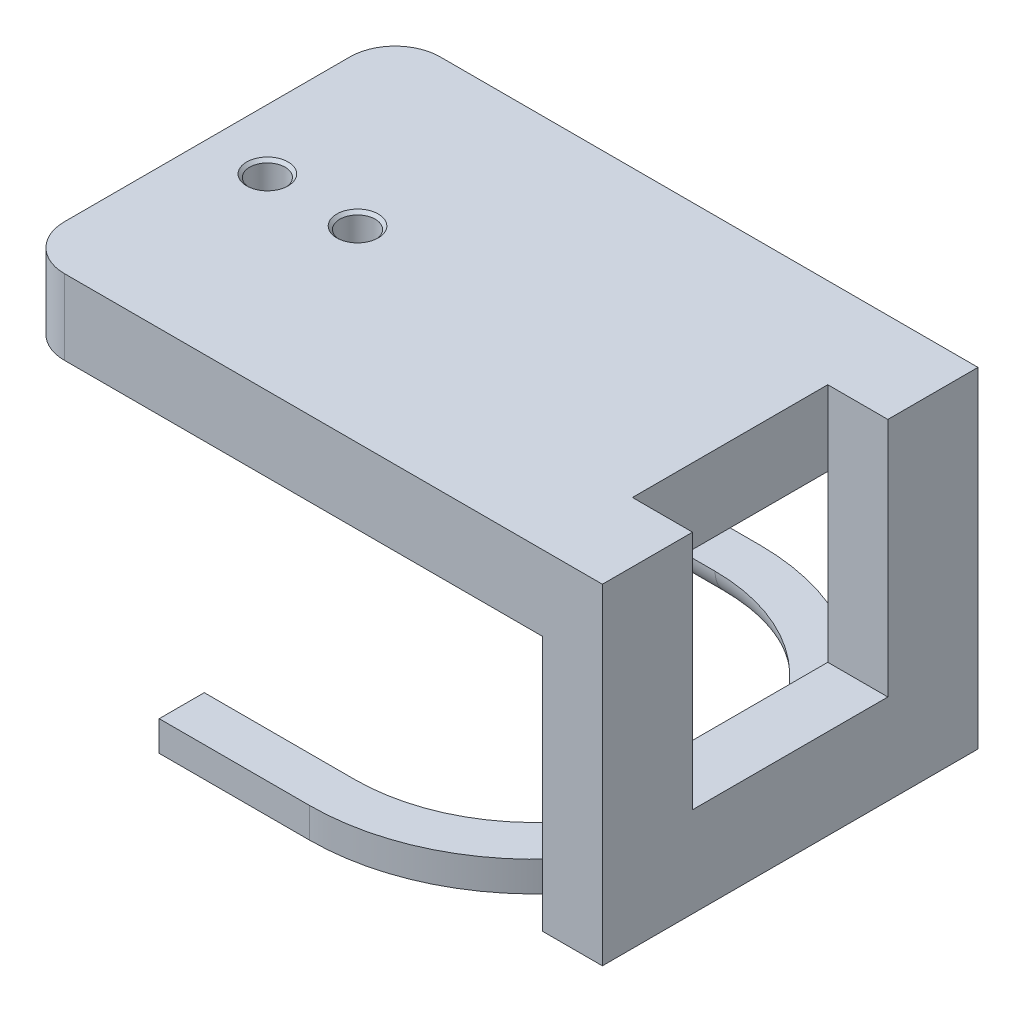
from build123d import *

# Parameters (mm, degrees)
SKETCH1_W             = 44.196
SKETCH1_H             = 31.75
BOSS_EXTRUDE1_DEPTH   = 6.35
F_3_0MM_DOWEL_HOLE1_D = 3
CHAMFER1_SIZE         = 0.254
FILLET2_R             = 3.81
BOSS_EXTRUDE4_DEPTH   = 5.08
EXTRUDE_THIN1_DEPTH   = 2.54
FILLET3_R             = 2.54


with BuildPart() as part:
    # Sketch1 → Boss-Extrude1 (new body)
    with BuildSketch(Plane(origin=(0, 0, 0), x_dir=(1, 0, 0), z_dir=(0, 1, 0))):
        with Locations((22.098, 15.875)):
            Rectangle(SKETCH1_W, SKETCH1_H)
    extrude(amount=BOSS_EXTRUDE1_DEPTH)

    # Ø3.0mm Dowel Hole1 (through all)
    with Locations(Plane(origin=(0, 6.35, 0), x_dir=(1, 0, 0), z_dir=(0, 1, 0))):
        with Locations((5.08, 15.875), (12.7, 15.875)):
            Hole(F_3_0MM_DOWEL_HOLE1_D / 2)

    # Chamfer1
    chamfer1_edges = [part.edges().sort_by_distance(p)[0] for p in [
        (14.2, 6.35, -15.875),
        (14.2, 0, -15.875),
        (6.58, 6.35, -15.875),
        (6.58, 0, -15.875),
    ]]
    chamfer(chamfer1_edges, length=CHAMFER1_SIZE)

    # Fillet2
    fillet2_edges = [part.edges().sort_by_distance(p)[0] for p in [
        (0, 3.175, -31.75),
        (0, 3.175, 0),
    ]]
    fillet(fillet2_edges, radius=FILLET2_R)

    # Sketch6 → Boss-Extrude4 (add)
    with BuildSketch(Plane(origin=(44.196, 0, 0), x_dir=(0, 0, -1), z_dir=(1, 0, 0))):
        Polygon((0, 6.35), (0, -21.59), (31.75, -21.59), (31.75, 6.35), (24.13, 6.35), (24.13, -13.97), (7.62, -13.97), (7.62, 6.35), align=None)
    extrude(amount=BOSS_EXTRUDE4_DEPTH)


with BuildPart() as body_2:
    # Sketch8 → Extrude-Thin1 (new body)
    with BuildSketch(Plane.XZ.offset(21.59)):
        with BuildLine():
            Line((14.986, -34.925), (27.686, -34.925))
            ThreePointArc((27.686, -34.925), (46.736, -15.875), (27.686, 3.175))
            Line((27.686, 3.175), (14.986, 3.175))
            Line((14.986, 3.175), (14.986, -0.635))
            Line((14.986, -0.635), (27.686, -0.635))
            ThreePointArc((27.686, -0.635), (42.926, -15.875), (27.686, -31.115))
            Line((27.686, -31.115), (14.986, -31.115))
            Line((14.986, -31.115), (14.986, -34.925))
        make_face()
    extrude(amount=-EXTRUDE_THIN1_DEPTH)

    # Fillet3
    fillet3_edges = [body_2.edges().sort_by_distance(p)[0] for p in [
        (21.336, -21.59, -0.635),
        (21.336, -21.59, -31.115),
        (42.926, -21.59, -15.875),
    ]]
    fillet(fillet3_edges, radius=FILLET3_R - 0.0001)  # a hair under: the kernel refuses the full size


solid = Compound([part.part, body_2.part])
